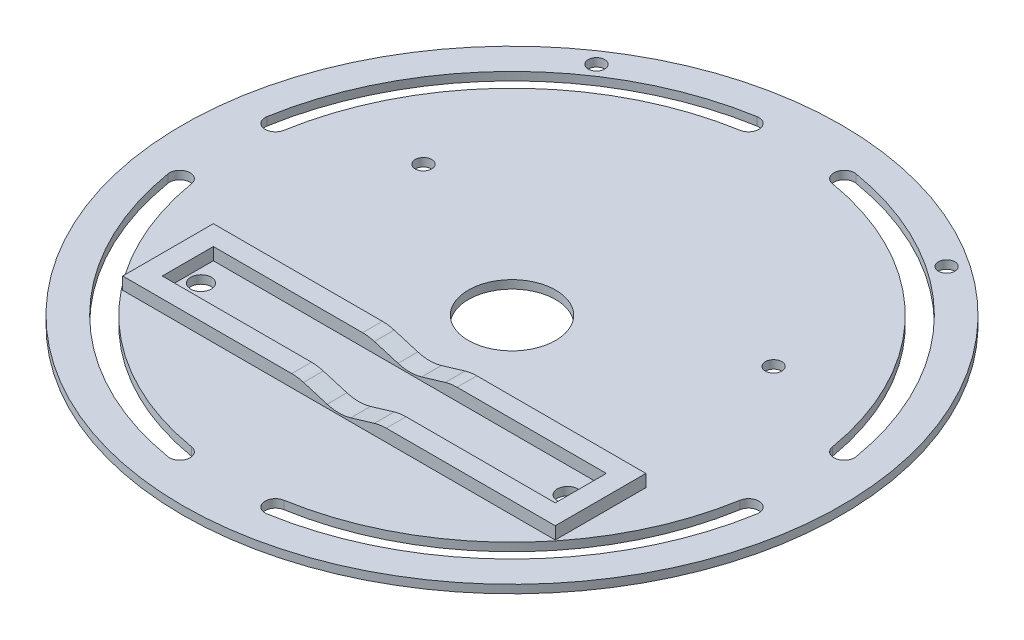
from build123d import *

# Parameters (mm, degrees)
SKETCH1_R           = 80
BOSS_EXTRUDE1_DEPTH = 2
CUT_EXTRUDE1_DEPTH  = 2
SKETCH3_R           = 2.5000000000000027
CUT_EXTRUDE2_DEPTH  = 114.15476127852509
SKETCH4_W           = 105.00000000000001
SKETCH4_H           = 21.999999999999993
SKETCH4_W_2         = 95
SKETCH4_H_2         = 12
BOSS_EXTRUDE2_DEPTH = 3
CUT_EXTRUDE3_DEPTH  = 146.9760254288354
FILLET1_R           = 10
SKETCH6_R           = 2.0000000000000036
CUT_EXTRUDE4_DEPTH  = 114.17685290111224
MOVE_FACE1_BY       = 0.2
MOVE_FACE1_2_BY     = 0.2
MOVE_FACE1_3_BY     = 0.2
MOVE_FACE1_4_BY     = 0.2
SKETCH7_R           = 10.6
CUT_EXTRUDE5_DEPTH  = 114.17685290111224


with BuildPart() as part:
    # Sketch1 → Boss-Extrude1 (new body)
    with BuildSketch(Plane(origin=(0, 0, 0), x_dir=(1, 0, 0), z_dir=(0, 1, 0))):
        Circle(SKETCH1_R)
    extrude(amount=BOSS_EXTRUDE1_DEPTH)

    # Sketch2 → Cut-Extrude1 (cut)
    with BuildSketch(Plane(origin=(0, 2, 0), x_dir=(1, 0, 0), z_dir=(0, 1, 0))):
        with BuildLine():
            ThreePointArc((-11.194987519973791, 66.5651729842839), (-9.14423991018458, 69.44517892888601), (-12.024245854786658, 71.49592653867526))
            ThreePointArc((-12.024245854786658, 71.49592653867526), (-51.265241636024435, 51.26524163602498), (-71.49592653867512, 12.02424585478741))
            ThreePointArc((-71.49592653867514, 12.024245854787408), (-69.44517892888592, 9.144239910185334), (-66.5651729842838, 11.194987519974491))
            ThreePointArc((-66.56517298428382, 11.194987519974493), (-47.72970773009176, 47.72970773009226), (-11.194987519973797, 66.56517298428392))
        make_face()
        with BuildLine():
            ThreePointArc((12.02424585478666, 71.49592653867526), (9.14423991018458, 69.44517892888601), (11.194987519973791, 66.5651729842839))
            ThreePointArc((11.194987519973797, 66.56517298428392), (47.729707730092095, 47.72970773009193), (66.56517298428396, 11.194987519973562))
            ThreePointArc((66.56517298428395, 11.19498751997356), (69.44517892888604, 9.144239910184341), (71.4959265386753, 12.024245854786408))
            ThreePointArc((71.49592653867529, 12.024245854786408), (51.265241636024804, 51.265241636024626), (12.02424585478666, 71.49592653867526))
        make_face()
        with BuildLine():
            ThreePointArc((71.49592653867522, -12.024245854786907), (69.44517892888598, -9.144239910184819), (66.56517298428386, -11.194987519974026))
            ThreePointArc((66.56517298428388, -11.194987519974019), (47.72970773009176, -47.729707730092265), (11.194987519973328, -66.565172984284))
            ThreePointArc((11.194987519973324, -66.56517298428399), (9.144239910184115, -69.44517892888608), (12.024245854786155, -71.49592653867535))
            ThreePointArc((12.024245854786159, -71.49592653867536), (51.26524163602445, -51.265241636024996), (71.49592653867523, -12.024245854786914))
        make_face()
        with BuildLine():
            ThreePointArc((-12.02424585478716, -71.49592653867518), (-9.144239910185082, -69.44517892888595), (-11.194987519974264, -66.56517298428383))
            ThreePointArc((-11.194987519974267, -66.56517298428385), (-47.72970773009242, -47.72970773009158), (-66.56517298428403, -11.194987519973097))
            ThreePointArc((-66.56517298428402, -11.194987519973095), (-69.4451789288861, -9.144239910183853), (-71.49592653867538, -12.024245854785907))
            ThreePointArc((-71.49592653867539, -12.02424585478591), (-51.26524163602516, -51.26524163602427), (-12.024245854787168, -71.49592653867518))
        make_face()
    extrude(amount=-CUT_EXTRUDE1_DEPTH, mode=Mode.SUBTRACT)

    # Sketch3 → Cut-Extrude2 (cut, through all)
    with BuildSketch(Plane(origin=(0, 2, 0), x_dir=(1, 0, 0), z_dir=(0, 1, 0))):
        with Locations((-44.49999999999999, -31.00000000000001)):
            Circle(SKETCH3_R)
        with Locations((44.50000000000001, -31)):
            Circle(SKETCH3_R)
    extrude(amount=-CUT_EXTRUDE2_DEPTH, mode=Mode.SUBTRACT)

    # Sketch4 → Boss-Extrude2 (add)
    with BuildSketch(Plane(origin=(0, 2, 0), x_dir=(1, 0, 0), z_dir=(0, 1, 0))):
        with Locations((0, -31.000000000000004)):
            Rectangle(SKETCH4_W, SKETCH4_H)
        with Locations((0, -31.000000000000007)):
            Rectangle(SKETCH4_W_2, SKETCH4_H_2, mode=Mode.SUBTRACT)
    extrude(amount=BOSS_EXTRUDE2_DEPTH)

    # Sketch5 → Cut-Extrude3 (cut, through all)
    with BuildSketch(Plane.XY.offset(42)):
        Polygon((3.469e-14, 2), (-10, 5.000000000000003), (10, 5.000000000000008), align=None)
    extrude(amount=-CUT_EXTRUDE3_DEPTH, mode=Mode.SUBTRACT)

    # Fillet1
    fillet1_edges = [part.edges().sort_by_distance(p)[0] for p in [
        (10, 5.000000000000008, 39.5),
        (10, 5.000000000000008, 22.500000000000007),
        (3.469e-14, 2, 22.500000000000007),
        (3.469e-14, 2, 39.5),
        (-10, 5.000000000000003, 39.5),
        (-10, 5.000000000000003, 22.500000000000007),
    ]]
    fillet(fillet1_edges, radius=FILLET1_R)

    # Sketch6 → Cut-Extrude4 (cut, through all)
    with BuildSketch(Plane(origin=(0, 2, 0), x_dir=(1, 0, 0), z_dir=(0, 1, 0))):
        with Locations((42.499999999999986, 63)):
            Circle(SKETCH6_R)
        with Locations((42.49999999999999, 20.999999999999996)):
            Circle(SKETCH6_R)
        with Locations((-42.49999999999999, 20.999999999999996)):
            Circle(SKETCH6_R)
        with Locations((-42.499999999999986, 63)):
            Circle(SKETCH6_R)
    extrude(amount=-CUT_EXTRUDE4_DEPTH, mode=Mode.SUBTRACT)

    # Move Face1: a face moved inward by 0.2
    extrude(part.faces().sort_by_distance((47.5, 3.5, 31))[0], amount=MOVE_FACE1_BY, dir=(1, 0, 0), mode=Mode.SUBTRACT)

    # Move Face1 2: a face moved inward by 0.2
    extrude(part.faces().sort_by_distance((0, 2.3, 37))[0], amount=MOVE_FACE1_2_BY, dir=(0, 0, 1), mode=Mode.SUBTRACT)

    # Move Face1 3: a face moved inward by 0.2
    extrude(part.faces().sort_by_distance((-47.5, 3.5, 31))[0], amount=MOVE_FACE1_3_BY, dir=(-1, 0, 0), mode=Mode.SUBTRACT)

    # Move Face1 4: a face moved inward by 0.2
    extrude(part.faces().sort_by_distance((0, 2.3, 25))[0], amount=MOVE_FACE1_4_BY, dir=(0, 0, -1), mode=Mode.SUBTRACT)

    # Sketch7 → Cut-Extrude5 (cut, through all)
    with BuildSketch(Plane(origin=(0, 2, 0), x_dir=(1, 0, 0), z_dir=(0, 1, 0))):
        Circle(SKETCH7_R)
    extrude(amount=-CUT_EXTRUDE5_DEPTH, mode=Mode.SUBTRACT)


solid = part.part
